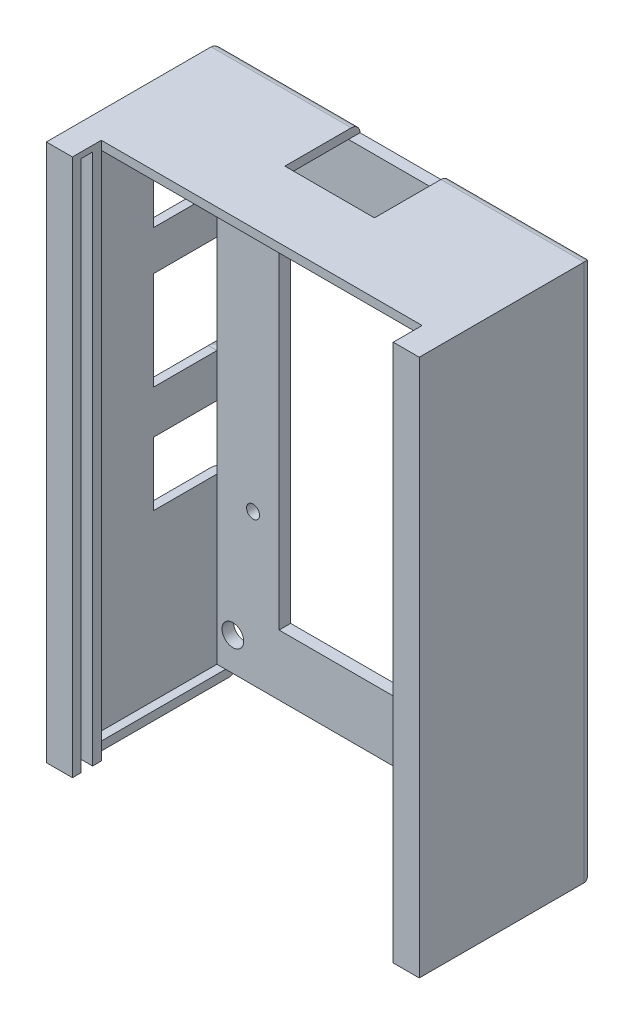
from build123d import *

# Parameters (mm, degrees)
BOSS_EXTRUDE8_START  = 25
SKETCH2_R            = 1.125
SKETCH2_W            = 40
SKETCH2_H            = 69
BOSS_EXTRUDE8_DEPTH  = 2
BOSS_EXTRUDE9_START  = 25
BOSS_EXTRUDE9_DEPTH  = 25
CUT_EXTRUDE5_START   = 25
SKETCH2_9_W          = 1.5
SKETCH2_9_H          = 17
SKETCH2_9_H_2        = 11
SKETCH2_9_H_3        = 12
CUT_EXTRUDE5_DEPTH   = 13
FILLET2_R            = 1.5
BOSS_EXTRUDE10_DEPTH = 4.5
SKETCH3_3_W          = 2
SKETCH3_3_H          = 92
BOSS_EXTRUDE11_DEPTH = 2.5
BOSS_EXTRUDE12_DEPTH = 4.5
SKETCH4_3_W          = 2
SKETCH4_3_H          = 92
BOSS_EXTRUDE13_DEPTH = 2.5
SKETCH5_R            = 1.875
CUT_EXTRUDE6_DEPTH   = 2


with BuildPart() as part:
    # Sketch2 → Boss-Extrude8 (new body)
    with BuildSketch(Plane.XY.offset(BOSS_EXTRUDE8_START)):
        Polygon((-30.75, -45), (30.75, -45), (30.75, 45), (-30.75, 45), (-30.75, 25.9), (-32.25, 25.9), (-32.25, 19), (-30.75, 19), (-30.75, 2), (-32.25, 2), (-32.25, -5.5), (-30.75, -5.5), align=None)
        with Locations((-24.5, -19)):
            Circle(SKETCH2_R, mode=Mode.SUBTRACT)
        Rectangle(SKETCH2_W, SKETCH2_H, mode=Mode.SUBTRACT)
        with Locations((24.5, -19)):
            Circle(SKETCH2_R, mode=Mode.SUBTRACT)
        with Locations((-24.5, 39)):
            Circle(SKETCH2_R, mode=Mode.SUBTRACT)
        with Locations((24.5, 39)):
            Circle(SKETCH2_R, mode=Mode.SUBTRACT)
    extrude(amount=BOSS_EXTRUDE8_DEPTH)

    # Sketch5 → Cut-Extrude6 (cut)
    with BuildSketch(Plane(origin=(0, 0, 25), x_dir=(-1, 0, 0), z_dir=(0, 0, -1))):
        with Locations((-28, 39.25)):
            Circle(SKETCH5_R)
        with Locations((28, 39.25)):
            Circle(SKETCH5_R)
        with Locations((28, -39.25)):
            Circle(SKETCH5_R)
        with Locations((-28, -39.25)):
            Circle(SKETCH5_R)
    extrude(amount=-CUT_EXTRUDE6_DEPTH, mode=Mode.SUBTRACT)


with BuildPart() as body_2:
    # Sketch2<8> → Boss-Extrude9 (new body)
    with BuildSketch(Plane.XY.offset(BOSS_EXTRUDE9_START)):
        Polygon((-32.25, 46.5), (-32.25, -46.5), (-29.25, -46.5), (-29.25, -45), (-30.75, -45), (-30.75, 45), (30.75, 45), (30.75, -45), (29.25, -45), (29.25, -46.5), (32.25, -46.5), (32.25, 46.5), align=None)
    extrude(amount=BOSS_EXTRUDE9_DEPTH)

    # Sketch2<9> → Cut-Extrude5 (cut)
    with BuildSketch(Plane.XY.offset(CUT_EXTRUDE5_START)):
        with Locations((-31.5, 10.5)):
            Rectangle(SKETCH2_9_W, SKETCH2_9_H)
        with Locations((-31.5, -11)):
            Rectangle(SKETCH2_9_W, SKETCH2_9_H_2)
        with Locations((-31.5, 31.9)):
            Rectangle(SKETCH2_9_W, SKETCH2_9_H_3)
        Polygon((-8, 46.5), (-8, 45), (7.5, 45), (7.5, 46.5), (0, 46.5), align=None)
    extrude(amount=CUT_EXTRUDE5_DEPTH, mode=Mode.SUBTRACT)

    # Fillet2
    fillet2_edges = [body_2.edges().sort_by_distance(p)[0] for p in [
        (-30.75, -46.5, 25),
        (30.75, -46.5, 25),
        (32.25, 0, 25),
        (19.875, 46.5, 25),
        (-20.125, 46.5, 25),
        (-32.25, 42.2, 25),
        (-32.25, 22.45, 25),
        (-32.25, -1.75, 25),
        (-32.25, -31.5, 25),
    ]]
    fillet(fillet2_edges, radius=FILLET2_R - 0.0001)  # a hair under: the kernel refuses the full size

    # Sketch3 → Boss-Extrude10 (add)
    with BuildSketch(Plane(origin=(32.25, 0, 0), x_dir=(0, 0, -1), z_dir=(1, 0, 0))):
        Polygon((-51.5, -46.5), (-50, -46.5), (-50, 46.5), (-55, 46.5), (-55, -46.5), (-53.5, -46.5), (-53.5, 45.5), (-51.5, 45.5), align=None)
    extrude(amount=-BOSS_EXTRUDE10_DEPTH)

    # Sketch3<3> → Boss-Extrude11 (add)
    with BuildSketch(Plane(origin=(32.25, 0, 0), x_dir=(0, 0, -1), z_dir=(1, 0, 0))):
        with Locations((-52.5, -0.5)):
            Rectangle(SKETCH3_3_W, SKETCH3_3_H)
    extrude(amount=-BOSS_EXTRUDE11_DEPTH)

    # Sketch4 → Boss-Extrude12 (add)
    with BuildSketch(Plane.ZY.offset(32.25)):
        Polygon((50, 46.5), (50, -46.5), (51.5, -46.5), (51.5, 45.5), (53.5, 45.5), (53.5, -46.5), (55, -46.5), (55, 46.5), align=None)
    extrude(amount=-BOSS_EXTRUDE12_DEPTH)

    # Sketch4<3> → Boss-Extrude13 (add)
    with BuildSketch(Plane.ZY.offset(32.25)):
        with Locations((52.5, -0.5)):
            Rectangle(SKETCH4_3_W, SKETCH4_3_H)
    extrude(amount=-BOSS_EXTRUDE13_DEPTH)


solid = Compound([part.part, body_2.part])
